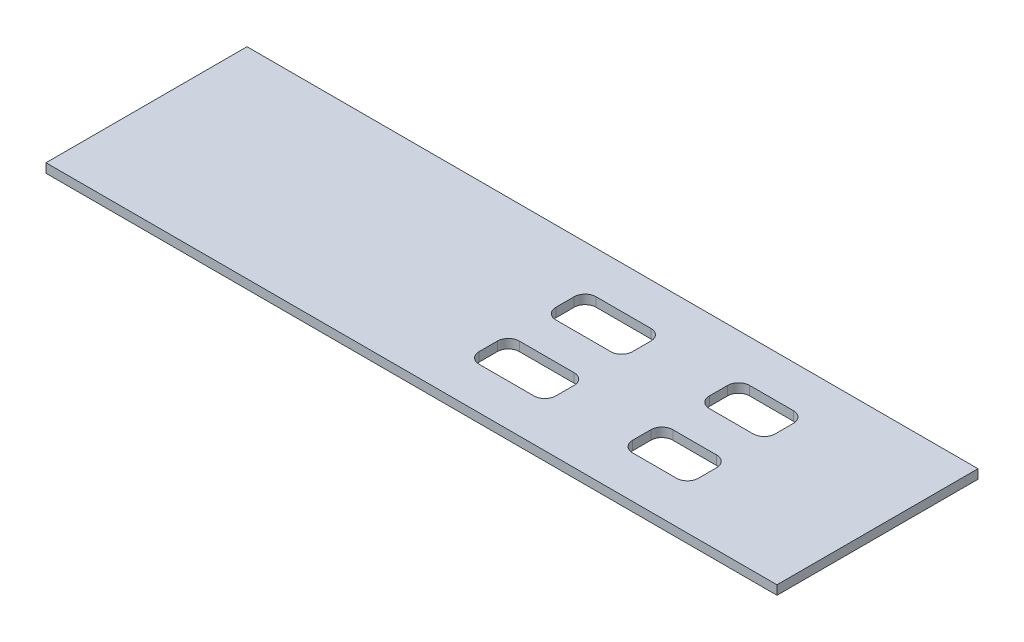
from build123d import *

# Parameters (mm, degrees)
SKETCH1_W           = 152.4
SKETCH1_H           = 69.85
BOSS_EXTRUDE1_DEPTH = 3.175
SKETCH2_W           = 26.67
SKETCH2_H           = 13.97
SKETCH2_W_2         = 22.86
CUT_EXTRUDE1_DEPTH  = 168.674873267
FILLET1_R           = 3.81
SKETCH4_W           = 69.85
SKETCH4_H           = 3.175
BOSS_EXTRUDE2_DEPTH = 101.6


with BuildPart() as part:
    # Sketch1 → Boss-Extrude1 (new body)
    with BuildSketch(Plane(origin=(0, 0, 0), x_dir=(1, 0, 0), z_dir=(0, 1, 0))):
        with Locations((76.2, 34.925)):
            Rectangle(SKETCH1_W, SKETCH1_H)
    extrude(amount=BOSS_EXTRUDE1_DEPTH)

    # Sketch2 → Cut-Extrude1 (cut, through all)
    with BuildSketch(Plane(origin=(0, 3.175, 0), x_dir=(1, 0, 0), z_dir=(0, 1, 0))):
        with Locations((43.815, 48.26)):
            Rectangle(SKETCH2_W, SKETCH2_H)
        with Locations((95.25, 48.26)):
            Rectangle(SKETCH2_W_2, SKETCH2_H)
        with Locations((43.815, 21.59)):
            Rectangle(SKETCH2_W, SKETCH2_H)
        with Locations((95.25, 21.59)):
            Rectangle(SKETCH2_W_2, SKETCH2_H)
    extrude(amount=-CUT_EXTRUDE1_DEPTH, mode=Mode.SUBTRACT)

    # Fillet1
    fillet1_edges = [part.edges().sort_by_distance(p)[0] for p in [
        (83.82, 1.5875, -14.605),
        (83.82, 1.5875, -41.275),
        (30.48, 1.5875, -41.275),
        (30.48, 1.5875, -14.605),
        (106.68, 1.5875, -14.605),
        (57.15, 1.5875, -41.275),
        (57.15, 1.5875, -14.605),
        (106.68, 1.5875, -41.275),
        (106.68, 1.5875, -28.575),
        (106.68, 1.5875, -55.245),
        (57.15, 1.5875, -28.575),
        (57.15, 1.5875, -55.245),
        (30.48, 1.5875, -28.575),
        (83.82, 1.5875, -28.575),
        (83.82, 1.5875, -55.245),
        (30.48, 1.5875, -55.245),
    ]]
    fillet(fillet1_edges, radius=FILLET1_R)

    # Sketch4 → Boss-Extrude2 (add)
    with BuildSketch(Plane.ZY):
        with Locations((-34.925, 1.5875)):
            Rectangle(SKETCH4_W, SKETCH4_H)
    extrude(amount=BOSS_EXTRUDE2_DEPTH)


solid = part.part
